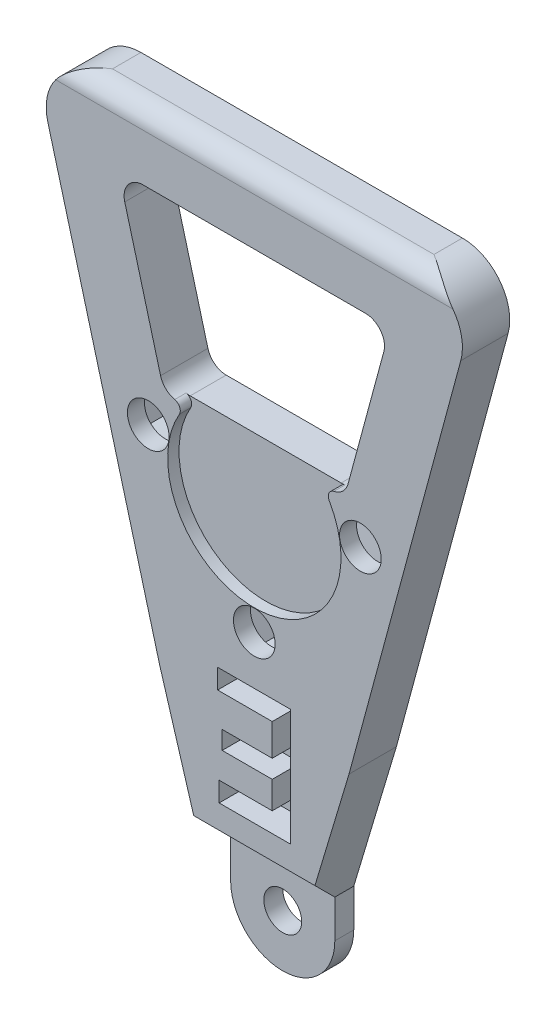
from build123d import *

# Parameters (mm, degrees)
BOSS_EXTRUDE1_DEPTH = 5
CUT_EXTRUDE1_REACH  = 36.673
SKETCH5_R           = 9.15
CUT_EXTRUDE3_DEPTH  = 1.2
CUT_EXTRUDE4_REACH  = 36.673
SKETCH6_R           = 2.2
CUT_EXTRUDE5_DEPTH  = 3.2
SKETCH8_W           = 20
SKETCH8_H           = 5
BOSS_EXTRUDE2_DEPTH = 15
SKETCH3_R           = 2
BOSS_EXTRUDE3_DEPTH = 5
CUT_EXTRUDE6_REACH  = 57.023
FILLET2_R           = 2
CUT_EXTRUDE7_DEPTH  = 3
CUT_EXTRUDE8_DEPTH  = 12.5
FILLET3_R           = 5
FILLET4_R           = 2
FILLET5_R           = 0.75


with BuildPart() as part:
    # Sketch1 → Boss-Extrude1 (new body)
    with BuildSketch(Plane.XY):
        Polygon((-23.5, 25), (23.5, 25), (10, -25), (-10, -25), align=None)
    extrude(amount=BOSS_EXTRUDE1_DEPTH)

    # Sketch2 → Cut-Extrude1 (cut, up to next)
    with BuildSketch(Plane.XY.offset(5), mode=Mode.PRIVATE) as cut_extrude1_sk1:
        Polygon((-9.499337961, 0), (9.499337961, 0), (14.359337961, 18), (-14.359337961, 18), align=None)
    cut_extrude1_tool1 = extrude(cut_extrude1_sk1.sketch, amount=-CUT_EXTRUDE1_REACH, mode=Mode.PRIVATE) & part.part
    add(cut_extrude1_tool1.solids().sort_by_distance((0, 9.611098, 5))[0], mode=Mode.SUBTRACT)

    # Sketch5 → Cut-Extrude3 (cut)
    with BuildSketch(Plane.XY.offset(5)):
        with Locations((0, -5.65)):
            Circle(SKETCH5_R)
    extrude(amount=-CUT_EXTRUDE3_DEPTH, mode=Mode.SUBTRACT)

    # Sketch6 → Cut-Extrude4 (cut, up to next)
    with BuildSketch(Plane.XY.offset(5), mode=Mode.PRIVATE) as cut_extrude4_sk1:
        with Locations((-11.197795542, -3.65)):
            Circle(SKETCH6_R)
    cut_extrude4_tool1 = extrude(cut_extrude4_sk1.sketch, amount=-CUT_EXTRUDE4_REACH, mode=Mode.PRIVATE) & part.part
    # Sketch6 → Cut-Extrude4 (cut, up to next)
    with BuildSketch(Plane.XY.offset(5), mode=Mode.PRIVATE) as cut_extrude4_sk2:
        with Locations((0, -17.025)):
            Circle(SKETCH6_R)
    cut_extrude4_tool2 = extrude(cut_extrude4_sk2.sketch, amount=-CUT_EXTRUDE4_REACH, mode=Mode.PRIVATE) & part.part
    # Sketch6 → Cut-Extrude4 (cut, up to next)
    with BuildSketch(Plane.XY.offset(5), mode=Mode.PRIVATE) as cut_extrude4_sk3:
        with Locations(Location((11.197795542, -3.65, 0), (0, 0, 180))):
            Circle(SKETCH6_R)
    cut_extrude4_tool3 = extrude(cut_extrude4_sk3.sketch, amount=-CUT_EXTRUDE4_REACH, mode=Mode.PRIVATE) & part.part
    add(cut_extrude4_tool1.solids().sort_by_distance((-11.197796, -3.65, 5))[0], mode=Mode.SUBTRACT)
    add(cut_extrude4_tool2.solids().sort_by_distance((0, -17.025, 5))[0], mode=Mode.SUBTRACT)
    add(cut_extrude4_tool3.solids().sort_by_distance((11.197796, -3.65, 5))[0], mode=Mode.SUBTRACT)

    # Sketch7 → Cut-Extrude5 (cut)
    with BuildSketch(Plane(origin=(0, 0, 0), x_dir=(-1, 0, 0), z_dir=(0, 0, -1))):
        Polygon((-7.208365159, -4.710791476), (-8.284407984, -0.72544768), (-12.273838367, 0.335343796), (-15.187225925, -2.589208524), (-14.1111831, -6.57455232), (-10.121752717, -7.635343796), align=None)
        Polygon((-4.128054425, -17.025), (-2.064027212, -20.6), (2.064027212, -20.6), (4.128054425, -17.025), (2.064027212, -13.45), (-2.064027212, -13.45), align=None)
        Polygon((10.121752717, -7.635343796), (14.1111831, -6.57455232), (15.187225925, -2.589208524), (12.273838367, 0.335343796), (8.284407984, -0.72544768), (7.208365159, -4.710791476), align=None)
    extrude(amount=-CUT_EXTRUDE5_DEPTH, mode=Mode.SUBTRACT)

    # Sketch8 → Boss-Extrude2 (add)
    with BuildSketch(Plane.XZ.offset(25)):
        with Locations((0, 2.5)):
            Rectangle(SKETCH8_W, SKETCH8_H)
    extrude(amount=BOSS_EXTRUDE2_DEPTH)

    # Sketch3 → Boss-Extrude3 (add)
    with BuildSketch(Plane.XY.offset(5)):
        with BuildLine():
            Line((-5.5, -44), (-5.5, -40))
            Line((-5.5, -40), (5.5, -40))
            Line((5.5, -40), (5.5, -44))
            ThreePointArc((5.5, -44), (0, -49.5), (-5.5, -44))
        make_face()
        with Locations((0, -44)):
            Circle(SKETCH3_R, mode=Mode.SUBTRACT)
    extrude(amount=-BOSS_EXTRUDE3_DEPTH)

    # Sketch9 → Cut-Extrude6 (cut, up to next)
    with BuildSketch(Plane(origin=(0, 0, 0), x_dir=(-1, 0, 0), z_dir=(0, 0, -1)), mode=Mode.PRIVATE) as cut_extrude6_sk1:
        Polygon((-10, -25), (-5.5, -40), (-10, -40), align=None)
    cut_extrude6_tool1 = extrude(cut_extrude6_sk1.sketch, amount=-CUT_EXTRUDE6_REACH, mode=Mode.PRIVATE) & part.part
    # Sketch9 → Cut-Extrude6 (cut, up to next)
    with BuildSketch(Plane(origin=(0, 0, 0), x_dir=(-1, 0, 0), z_dir=(0, 0, -1)), mode=Mode.PRIVATE) as cut_extrude6_sk2:
        Polygon((10, -25), (5.5, -40), (10, -40), align=None)
    cut_extrude6_tool2 = extrude(cut_extrude6_sk2.sketch, amount=-CUT_EXTRUDE6_REACH, mode=Mode.PRIVATE) & part.part
    add(cut_extrude6_tool1.solids().sort_by_distance((8.5, -35, 0))[0], mode=Mode.SUBTRACT)
    add(cut_extrude6_tool2.solids().sort_by_distance((-8.5, -35, 0))[0], mode=Mode.SUBTRACT)

    # Fillet2
    fillet2_edges = [part.edges().sort_by_distance(p)[0] for p in [
        (-9.499337961, 0, 2.5),
        (-14.359337961, 18, 2.5),
        (14.359337961, 18, 2.5),
        (9.499337961, 0, 2.5),
    ]]
    fillet(fillet2_edges, radius=FILLET2_R)

    # Sketch12 → Cut-Extrude7 (cut)
    with BuildSketch(Plane.XY.offset(5)):
        Polygon((3.812269091, -22.169612745), (3.812269091, -34.497542433), (-3.712571108, -34.497542433), (-3.712571108, -32.416203654), (1.891033295, -32.416203654), (1.891033295, -29.534349961), (-3.392365142, -29.534349961), (-3.392365142, -27.613114166), (1.891033295, -27.613114166), (1.891033295, -24.250951523), (-3.872674091, -24.250951523), (-3.872674091, -22.169612745), align=None)
    extrude(amount=-CUT_EXTRUDE7_DEPTH, mode=Mode.SUBTRACT)

    # Sketch13 → Cut-Extrude8 (cut, symmetric)
    with BuildSketch(Plane.ZY.offset(5.5)):
        Polygon((5, -37), (2, -40), (2, -51.866140446), (5, -51.866140446), align=None)
    extrude(amount=CUT_EXTRUDE8_DEPTH, both=True, mode=Mode.SUBTRACT)

    # Fillet3
    fillet3_edges = [part.edges().sort_by_distance(p)[0] for p in [
        (-23.5, 25, 2.5),
        (23.5, 25, 2.5),
    ]]
    fillet(fillet3_edges, radius=FILLET3_R)

    # Fillet4
    # the kernel refuses this fillet: 2 mm, written as the material it takes off along each edge
    with BuildSketch(Plane(origin=(-21.970955687, 25, 5), x_dir=(0, 0, -1), z_dir=(1, 0, 0))) as fillet4_piece_1:
        with BuildLine():
            CenterArc((FILLET4_R, -FILLET4_R), FILLET4_R, 90, 90)
            Line((0, -FILLET4_R), (0, 0))
            Line((0, 0), (FILLET4_R, 0))
        make_face()
    extrude(amount=43.941911373, mode=Mode.SUBTRACT)

    # Fillet5
    # the kernel refuses this fillet: 0.75 mm, written as the material it takes off along each edge
    with BuildSketch(Plane(origin=(-7.197221686, 0, 3.8), x_dir=(-0.999217435066786, 0.03955398157649034, 0), z_dir=(0, 0, 1))) as fillet5_piece_1:
        with BuildLine():
            CenterArc((1.339281213, 0.737984469), FILLET5_R, 152.162782465, 107.567464563)
            Line((0.676072834, 1.088205323), (0.609751996, 1.123227408))
            ThreePointArc((0.609751996, 1.123227408), (0.293398819, 0.571834806), (-0.060779257, 0.043941801))
            Line((-0.060779257, 0.043941801), (0.002966549, -0.074941308))
            ThreePointArc((0.002966549, -0.074941308), (0.772862133, -0.044465022), (1.192197913, -0.073798447))
            Line((1.192197913, -0.073798447), (1.205569122, 0))
        make_face()
    extrude(amount=4.402796923, mode=Mode.SUBTRACT)
    with BuildSketch(Plane(origin=(7.197221686, 0, 3.8), x_dir=(0.999217435066786, 0.039553981576491995, 0), z_dir=(0, 0, 1))) as fillet5_piece_2:
        with BuildLine():
            CenterArc((1.339281213, -0.737984469), FILLET5_R, 100.269752973, 107.567464563)
            Line((0.676072834, -1.088205323), (0.609751996, -1.123227408))
            ThreePointArc((0.609751996, -1.123227408), (0.293398819, -0.571834806), (-0.060779257, -0.043941801))
            Line((-0.060779257, -0.043941801), (0.002966549, 0.074941308))
            ThreePointArc((0.002966549, 0.074941308), (0.772862133, 0.044465022), (1.192197913, 0.073798447))
            Line((1.192197913, 0.073798447), (1.205569122, 0))
        make_face()
    extrude(amount=4.402796923, mode=Mode.SUBTRACT)


solid = part.part
